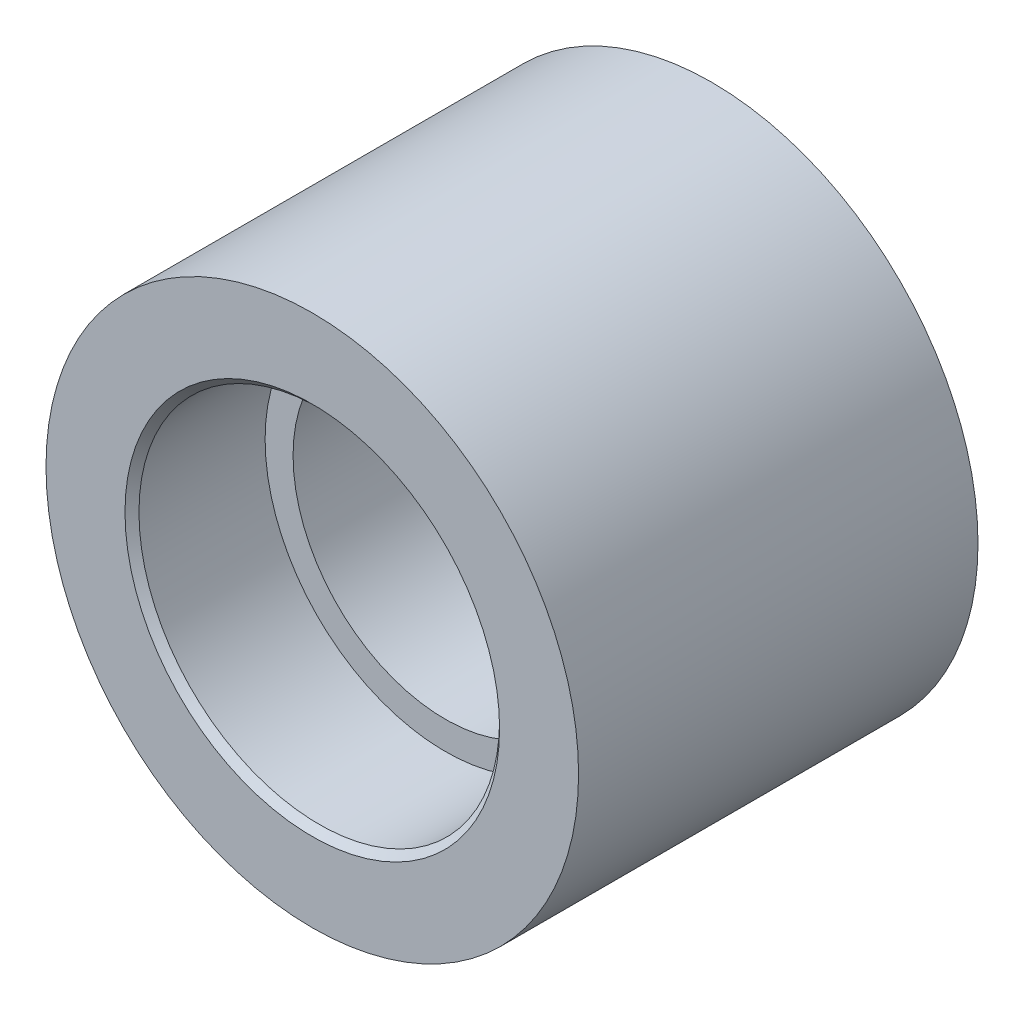
from build123d import *

# Parameters (mm, degrees)
SKETCH1_R           = 9.525
SKETCH1_R_2         = 6.45
BOSS_EXTRUDE1_DEPTH = 14.2875
SKETCH2_R           = 6.45
SKETCH2_R_2         = 5.45
BOSS_EXTRUDE2_DEPTH = 2.38125
CHAMFER1_SIZE       = 0.25


with BuildPart() as part:
    # Sketch1 → Boss-Extrude1 (new body)
    with BuildSketch(Plane.XY):
        Circle(SKETCH1_R)
        Circle(SKETCH1_R_2, mode=Mode.SUBTRACT)
    extrude(amount=BOSS_EXTRUDE1_DEPTH)

    # Sketch2 → Boss-Extrude2 (add, symmetric)
    with BuildSketch(Plane.XY.offset(7.14375)):
        Circle(SKETCH2_R)
        Circle(SKETCH2_R_2, mode=Mode.SUBTRACT)
    extrude(amount=BOSS_EXTRUDE2_DEPTH, both=True)

    # Chamfer1
    chamfer1_edges = [part.edges().sort_by_distance(p)[0] for p in [
        (-6.45, 0, 0),
        (-6.45, 0, 14.2875),
    ]]
    chamfer(chamfer1_edges, length=CHAMFER1_SIZE)


solid = part.part
